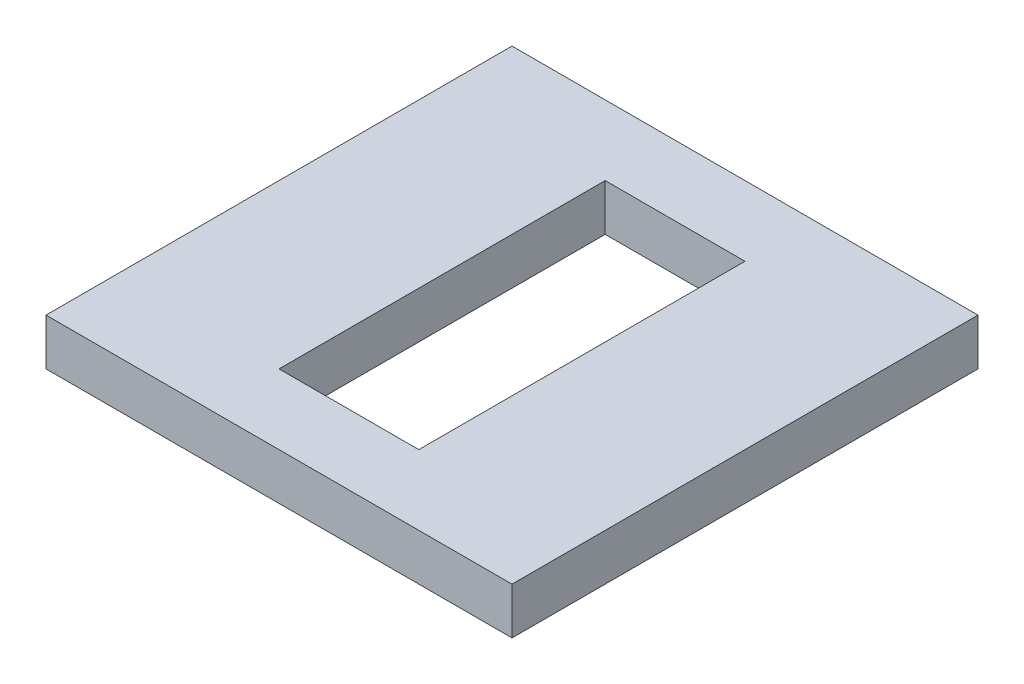
from build123d import *

# Parameters (mm, degrees)
SKETCH1_W           = 100
SKETCH1_H           = 100
SKETCH1_W_2         = 30
SKETCH1_H_2         = 70
BOSS_EXTRUDE1_DEPTH = 10


with BuildPart() as part:
    # Sketch1 → Boss-Extrude1 (new body)
    with BuildSketch(Plane(origin=(0, 0, 0), x_dir=(1, 0, 0), z_dir=(0, 1, 0))):
        with Locations((0.697674419, -9.418604651)):
            Rectangle(SKETCH1_W, SKETCH1_H)
        with Locations((0.697674419, -9.418604651)):
            Rectangle(SKETCH1_W_2, SKETCH1_H_2, mode=Mode.SUBTRACT)
    extrude(amount=BOSS_EXTRUDE1_DEPTH)


solid = part.part
